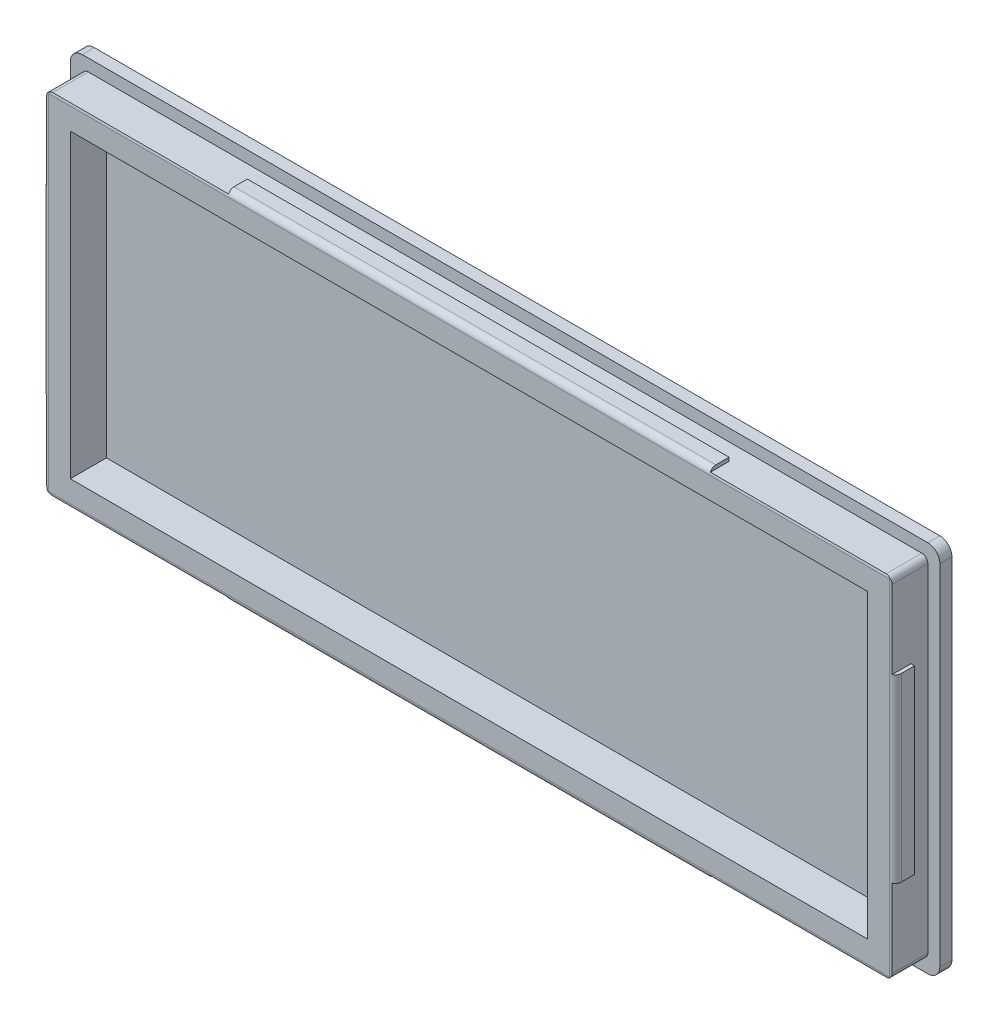
from build123d import *

# Parameters (mm, degrees)
BOSS_EXTRUDE1_DEPTH = 1
SKETCH2_W           = 66.2
SKETCH2_H           = 25
BOSS_EXTRUDE2_DEPTH = 3
SKETCH3_W           = 0.3
SKETCH3_H           = 15
SKETCH3_W_2         = 40
SKETCH3_H_2         = 0.3
BOSS_EXTRUDE3_DEPTH = 1.6
FILLET1_START       = 1
FILLET1_DEPTH       = 70.2
FILLET1_2_DEPTH     = 31


with BuildPart() as part:
    # Sketch1 → Boss-Extrude1 (new body)
    with BuildSketch(Plane.XY):
        with BuildLine():
            Line((1, 0), (71.2, 0))
            ThreePointArc((71.2, 0), (71.907106781, 0.292893219), (72.2, 1))
            Line((72.2, 1), (72.2, 30))
            ThreePointArc((72.2, 30), (71.907106781, 30.707106781), (71.2, 31))
            Line((71.2, 31), (1, 31))
            ThreePointArc((1, 31), (0.292893219, 30.707106781), (0, 30))
            Line((0, 30), (0, 1))
            ThreePointArc((0, 1), (0.292893219, 0.292893219), (1, 0))
        make_face()
    extrude(amount=BOSS_EXTRUDE1_DEPTH)

    # Sketch2 → Boss-Extrude2 (add)
    with BuildSketch(Plane.XY.offset(1)):
        with BuildLine():
            Line((1.5, 30), (70.7, 30))
            ThreePointArc((70.7, 30), (71.053553391, 29.853553391), (71.2, 29.5))
            Line((71.2, 29.5), (71.2, 1.5))
            ThreePointArc((71.2, 1.5), (71.053553391, 1.146446609), (70.7, 1))
            Line((70.7, 1), (1.5, 1))
            ThreePointArc((1.5, 1), (1.146446609, 1.146446609), (1, 1.5))
            Line((1, 1.5), (1, 29.5))
            ThreePointArc((1, 29.5), (1.146446609, 29.853553391), (1.5, 30))
        make_face()
        with Locations((36.1, 15.5)):
            Rectangle(SKETCH2_W, SKETCH2_H, mode=Mode.SUBTRACT)
    extrude(amount=BOSS_EXTRUDE2_DEPTH)

    # Sketch3 → Boss-Extrude3 (add)
    with BuildSketch(Plane.XY.offset(4)):
        with Locations((71.35, 15.5)):
            Rectangle(SKETCH3_W, SKETCH3_H)
        with Locations((36.1, 30.15)):
            Rectangle(SKETCH3_W_2, SKETCH3_H_2)
        with Locations((0.85, 15.5)):
            Rectangle(SKETCH3_W, SKETCH3_H)
        with Locations((36, 0.85)):
            Rectangle(SKETCH3_W_2, SKETCH3_H_2)
    extrude(amount=-BOSS_EXTRUDE3_DEPTH)

    # Fillet1: read off the stored shape, not the designer's step
    # Fillet1 outline → Fillet1 (cut)
    with BuildSketch(Plane.YZ.offset(FILLET1_START)):
        with BuildLine():
            ThreePointArc((29.8, 4), (30.153553391, 3.853553391), (30.3, 3.5))
            Line((30.3, 3.5), (30.3, 4))
            Line((30.3, 4), (29.8, 4))
        make_face()
        with BuildLine():
            Line((1.2, 4), (0.7, 4))
            Line((0.7, 4), (0.7, 3.5))
            ThreePointArc((0.7, 3.5), (0.846446609, 3.853553391), (1.2, 4))
        make_face()
    extrude(amount=FILLET1_DEPTH, mode=Mode.SUBTRACT)

    # Fillet1 2 outline → Fillet1 2 (cut)
    with BuildSketch(Plane(origin=(0, 0, 0), x_dir=(1, 0, 0), z_dir=(0, 1, 0))):
        with BuildLine():
            ThreePointArc((1.2, -4), (0.846446609, -3.853553391), (0.7, -3.5))
            Line((0.7, -3.5), (0.7, -4))
            Line((0.7, -4), (1.2, -4))
        make_face()
        with BuildLine():
            Line((71, -4), (71.5, -4))
            Line((71.5, -4), (71.5, -3.5))
            ThreePointArc((71.5, -3.5), (71.353553391, -3.853553391), (71, -4))
        make_face()
    extrude(amount=FILLET1_2_DEPTH, mode=Mode.SUBTRACT)


solid = part.part
